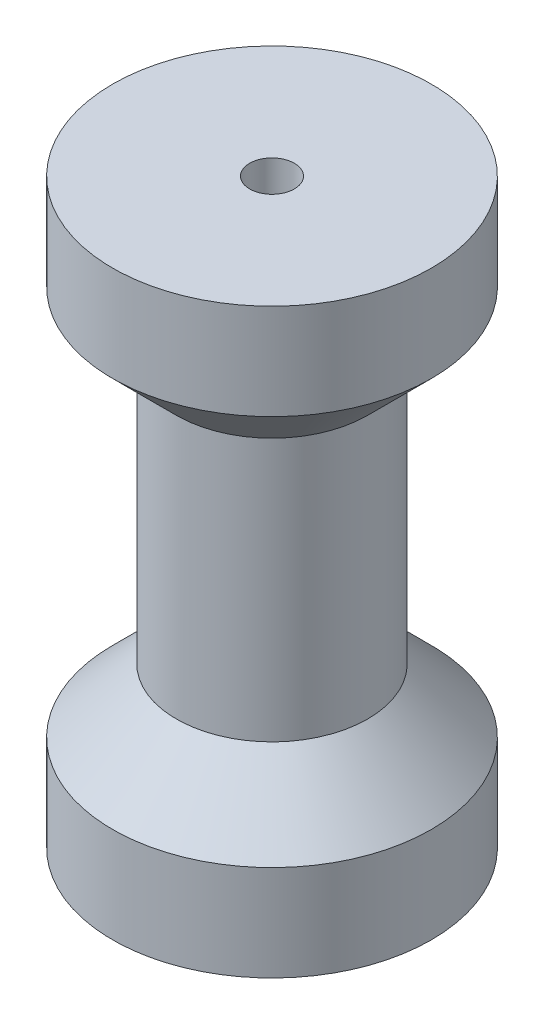
from build123d import *

# Parameters (mm, degrees)
CHAMFER1_SIZE = 4


with BuildPart() as part:
    # Sketch1 → Revolve1 (revolve)
    with BuildSketch(Plane.XY):
        Polygon((1.4, 0), (1.4, 36.5), (10, 36.5), (10, 30.5), (6, 30.5), (6, 6), (10, 6), (10, 0), align=None)
    revolve(axis=Axis((0, -42.821890518, 0), (0, 1, 0)))

    # Chamfer1
    chamfer1_edges = [part.edges().sort_by_distance(p)[0] for p in [
        (-6, 6, 0),
        (-6, 30.5, 0),
    ]]
    chamfer(chamfer1_edges, length=CHAMFER1_SIZE - 0.0001)  # a hair under: the kernel refuses the full size


solid = part.part
